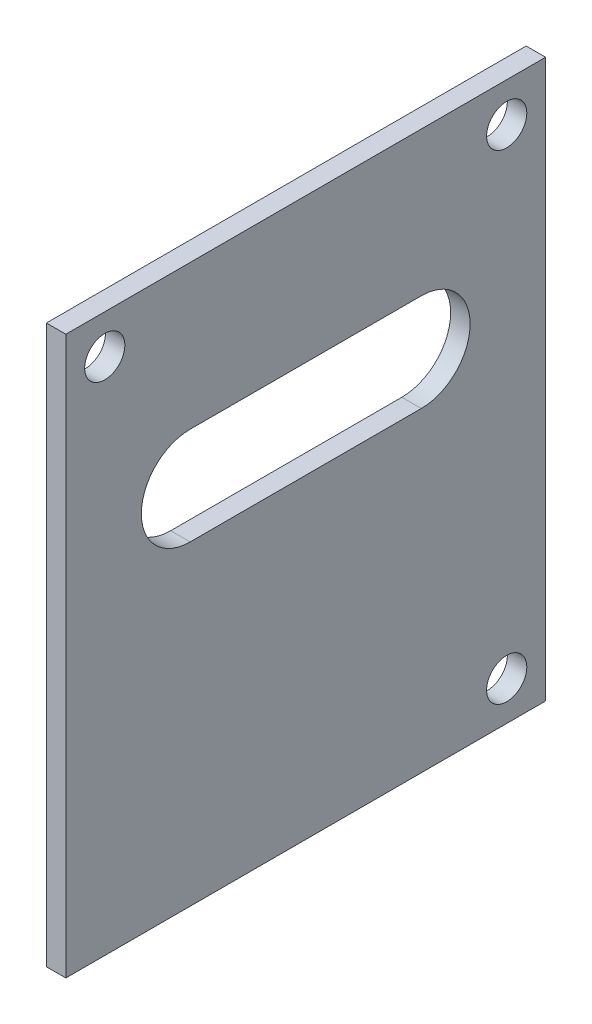
from build123d import *

# Parameters (mm, degrees)
SKETCH1_W           = 37
SKETCH1_H           = 43
SKETCH1_R           = 1.55
BOSS_EXTRUDE1_DEPTH = 1.5


with BuildPart() as part:
    # Sketch1 → Boss-Extrude1 (new body)
    with BuildSketch(Plane(origin=(0, 0, 0), x_dir=(0, 0, -1), z_dir=(1, 0, 0))):
        Rectangle(SKETCH1_W, SKETCH1_H)
        with Locations((15.5, -18.5)):
            Circle(SKETCH1_R, mode=Mode.SUBTRACT)
        with Locations((-15.5, 18.5)):
            Circle(SKETCH1_R, mode=Mode.SUBTRACT)
        with BuildLine():
            ThreePointArc((-8.913565791, 2.832517152), (-12.676811661, 6.595763022), (-8.913565791, 10.359008893))
            Line((-8.913565791, 10.359008893), (8.913565791, 10.359008893))
            ThreePointArc((8.913565791, 10.359008893), (12.676811661, 6.595763022), (8.913565791, 2.832517152))
            Line((8.913565791, 2.832517152), (-8.913565791, 2.832517152))
        make_face(mode=Mode.SUBTRACT)
        with Locations((15.5, 18.5)):
            Circle(SKETCH1_R, mode=Mode.SUBTRACT)
    extrude(amount=BOSS_EXTRUDE1_DEPTH)


solid = part.part
